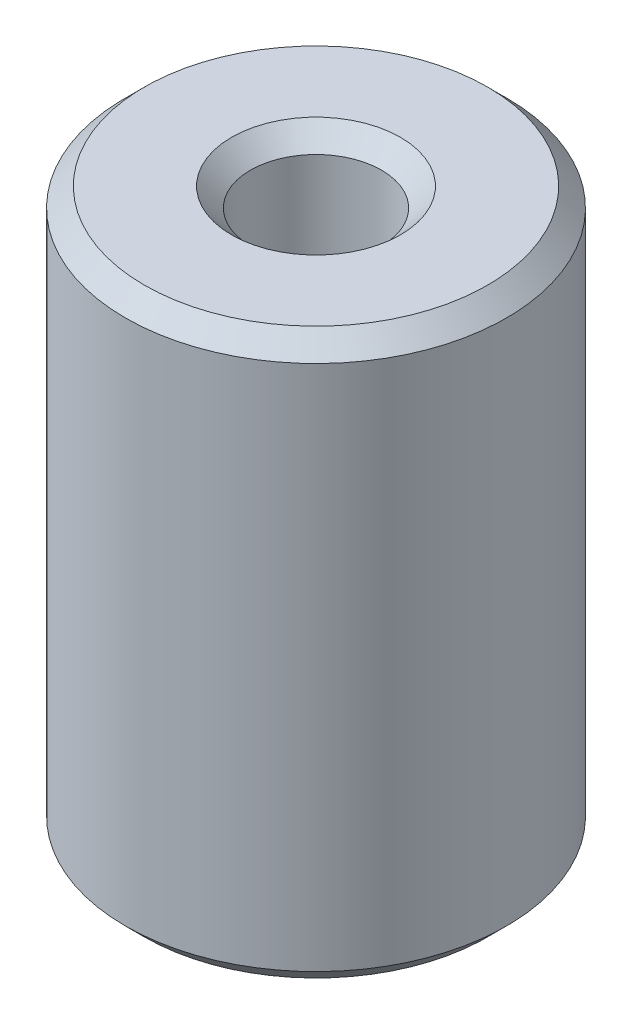
from build123d import *

# Parameters (mm, degrees)
SKETCH1_R           = 7.5
BOSS_EXTRUDE1_DEPTH = 22.217883384
SKETCH2_R           = 2.579451899
CUT_EXTRUDE1_DEPTH  = 25.619795735
CHAMFER1_SIZE       = 0.745715691


with BuildPart() as part:
    # Sketch1 → Boss-Extrude1 (new body)
    with BuildSketch(Plane(origin=(0, 0, 0), x_dir=(1, 0, 0), z_dir=(0, 1, 0))):
        Circle(SKETCH1_R)
    extrude(amount=BOSS_EXTRUDE1_DEPTH)

    # Sketch2 → Cut-Extrude1 (cut, through all)
    with BuildSketch(Plane(origin=(0, 0, 0), x_dir=(1, 0, 0), z_dir=(0, 1, 0))):
        Circle(SKETCH2_R)
    extrude(amount=CUT_EXTRUDE1_DEPTH, mode=Mode.SUBTRACT)

    # Chamfer1
    chamfer1_edges = [part.edges().sort_by_distance(p)[0] for p in [
        (-2.579451899, 22.217883384, 0),
        (-2.579451899, 0, 0),
        (-7.5, 0, 0),
        (-7.5, 22.217883384, 0),
    ]]
    chamfer(chamfer1_edges, length=CHAMFER1_SIZE)


solid = part.part
